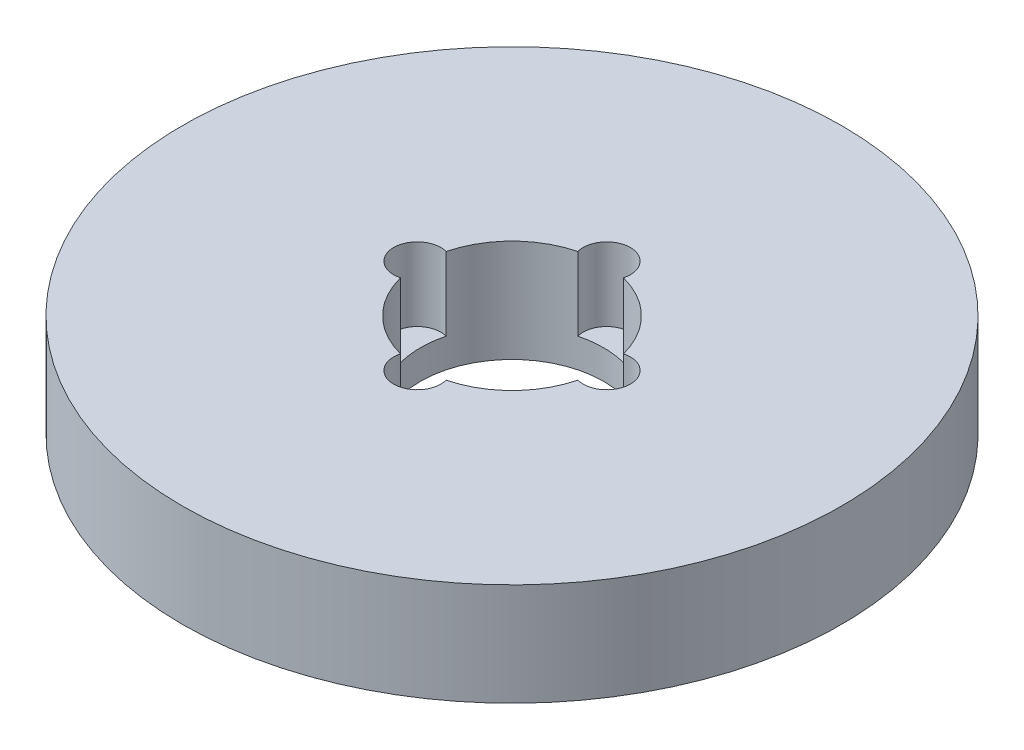
from build123d import *

# Parameters (mm, degrees)
SKETCH1_R           = 45
BOSS_EXTRUDE1_DEPTH = 14
SKETCH2_R           = 12.5
CUT_EXTRUDE1_DEPTH  = 66.161338231
SKETCH3_R           = 3.223316902
CUT_EXTRUDE2_DEPTH  = 10.016274352
CIRPATTERN1_COUNT   = 4


with BuildPart() as part:
    # Sketch1 → Boss-Extrude1 (new body)
    with BuildSketch(Plane(origin=(0, 0, 0), x_dir=(1, 0, 0), z_dir=(0, 1, 0))):
        Circle(SKETCH1_R)
    extrude(amount=BOSS_EXTRUDE1_DEPTH)

    # Sketch2 → Cut-Extrude1 (cut, through all)
    with BuildSketch(Plane(origin=(0, 0, 0), x_dir=(1, 0, 0), z_dir=(0, 1, 0))):
        Circle(SKETCH2_R)
    extrude(amount=CUT_EXTRUDE1_DEPTH, mode=Mode.SUBTRACT)

    # Sketch3 → Cut-Extrude2 (cut)
    with BuildSketch(Plane(origin=(0, 14, 0), x_dir=(1, 0, 0), z_dir=(0, 1, 0))):
        with Locations((-12.936869441, 0)):
            Circle(SKETCH3_R)
    cut_extrude2 = extrude(amount=-CUT_EXTRUDE2_DEPTH, mode=Mode.SUBTRACT)

    # CirPattern1: Cut-Extrude2 ×4 about axis
    cirpattern1_axis = Axis((0, 0, 0), (0, 1, 0))
    for i in range(1, CIRPATTERN1_COUNT):
        add(cut_extrude2.rotate(cirpattern1_axis, i * 360 / CIRPATTERN1_COUNT), mode=Mode.SUBTRACT)


solid = part.part
